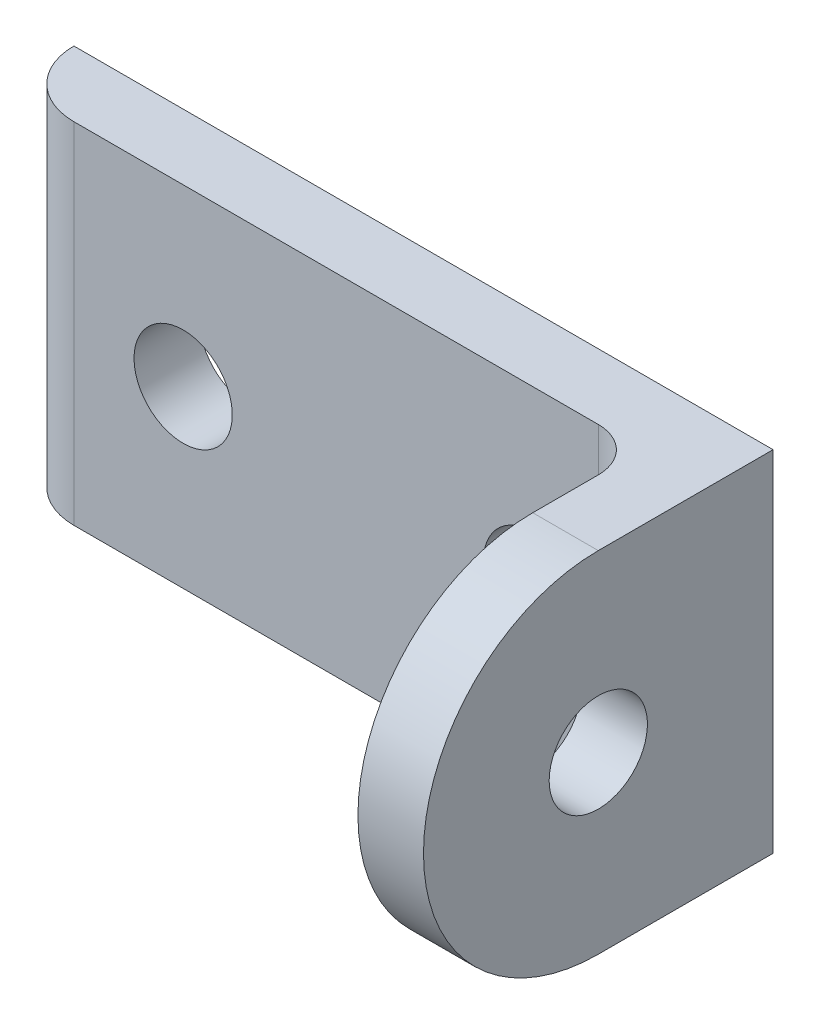
from build123d import *

# Parameters (mm, degrees)
BOSS_EXTRUDE1_START        = -25.4
BOSS_EXTRUDE1_DEPTH        = 25.4
BOSS_EXTRUDE2_DEPTH        = 4.7625
M6_5_CLEARANCE_HOLE1_D     = 7.1374
M6_5_CLEARANCE_HOLE1_DEPTH = 25.4
M6_5_CLEARANCE_HOLE2_D     = 7.1374
FILLET1_R                  = 3.175


with BuildPart() as part:
    # Boss-Extrude1: read off the stored shape, not the designer's step
    # Boss-Extrude1 outline → Boss-Extrude1 (new body)
    with BuildSketch(Plane(origin=(0, 0, 0), x_dir=(1, 0, 0), z_dir=(0, 1, 0)).offset(BOSS_EXTRUDE1_START)):
        with BuildLine():
            Line((-4.7625, -4.7625), (-4.7625, 0))
            Line((-4.7625, 0), (-50.8, 0))
            ThreePointArc((-50.8, 0), (-49.405096045, -3.367596045), (-46.0375, -4.7625))
            Line((-46.0375, -4.7625), (-4.7625, -4.7625))
        make_face()
    extrude(amount=BOSS_EXTRUDE1_DEPTH)

    # Sketch2 → Boss-Extrude2 (add)
    with BuildSketch(Plane(origin=(-4.7625, 0, 0), x_dir=(0, 0, -1), z_dir=(1, 0, 0))):
        with BuildLine():
            Line((0, 0), (0, -25.4))
            Line((0, -25.4), (-12.7, -25.4))
            ThreePointArc((-12.7, -25.4), (-25.4, -12.7), (-12.7, 0))
            Line((-12.7, 0), (0, 0))
        make_face()
    extrude(amount=BOSS_EXTRUDE2_DEPTH)

    # M6.5 Clearance Hole1
    with Locations(Plane(origin=(0, 0, 0), x_dir=(-1, 0, 0), z_dir=(0, 0, -1))):
        with Locations((38.1, -12.7), (12.7, -12.7)):
            Hole(M6_5_CLEARANCE_HOLE1_D / 2, depth=M6_5_CLEARANCE_HOLE1_DEPTH)

    # M6.5 Clearance Hole2 (through all)
    with Locations(Plane.ZY.offset(4.7625)):
        with Locations((12.7, -12.7)):
            Hole(M6_5_CLEARANCE_HOLE2_D / 2)

    # Fillet1
    fillet1_edges = [part.edges().sort_by_distance(p)[0] for p in [
        (-4.7625, -12.7, 4.7625),
    ]]
    fillet(fillet1_edges, radius=FILLET1_R)


solid = part.part
